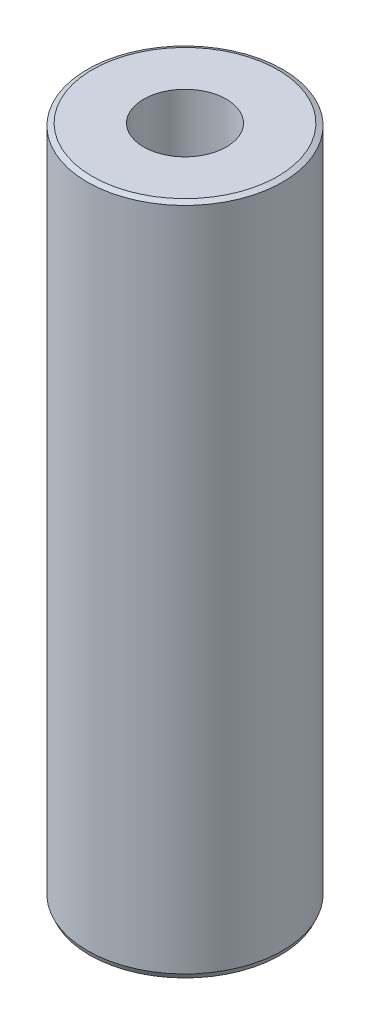
from build123d import *
from OCP.BRepFilletAPI import BRepFilletAPI_MakeChamfer

# Parameters (mm, degrees)
SKETCH1_R           = 27.5
BOSS_EXTRUDE1_DEPTH = 189.476186639
SKETCH2_R           = 11.658518512
CUT_EXTRUDE1_DEPTH  = 194.42627873
CHAMFER1_SIZE       = 0.648812284
CHAMFER1_SIZE2      = 1.432687955


with BuildPart() as part:
    # Sketch1 → Boss-Extrude1 (new body)
    with BuildSketch(Plane(origin=(0, 0, 0), x_dir=(1, 0, 0), z_dir=(0, 1, 0))):
        Circle(SKETCH1_R)
    extrude(amount=BOSS_EXTRUDE1_DEPTH)

    # Sketch2 → Cut-Extrude1 (cut, through all)
    with BuildSketch(Plane(origin=(0, 0, 0), x_dir=(1, 0, 0), z_dir=(0, 1, 0))):
        Circle(SKETCH2_R)
    extrude(amount=CUT_EXTRUDE1_DEPTH, mode=Mode.SUBTRACT)

    # Chamfer1: one chamfer whose edges measure the first distance from different faces: ONE call of the kernel's chamfer builder (chamfer() names one face for all edges)
    chamfer1_edges_1 = [part.edges().sort_by_distance(p)[0] for p in [
        (-27.5, 189.476186639, 0),
    ]]
    chamfer1_side_1 = [part.faces().sort_by_distance(p)[0] for p in [
        (-27.5, 94.73809332, 0),
    ]]
    chamfer1_edges_2 = [part.edges().sort_by_distance(p)[0] for p in [
        (-27.5, 0, 0),
    ]]
    chamfer1_side_2 = [part.faces().sort_by_distance(p)[0] for p in [
        (-26.722182541, 0, 0),
    ]]
    chamfer1 = BRepFilletAPI_MakeChamfer(part.part.solid().wrapped)
    for e in chamfer1_edges_1:
        chamfer1.Add(CHAMFER1_SIZE, CHAMFER1_SIZE2, e.wrapped, chamfer1_side_1[0].wrapped)  # the first distance lies on this face
    for e in chamfer1_edges_2:
        chamfer1.Add(CHAMFER1_SIZE, CHAMFER1_SIZE2, e.wrapped, chamfer1_side_2[0].wrapped)  # the first distance lies on this face
    add(Compound.cast(chamfer1.Shape()), mode=Mode.REPLACE)


solid = part.part
